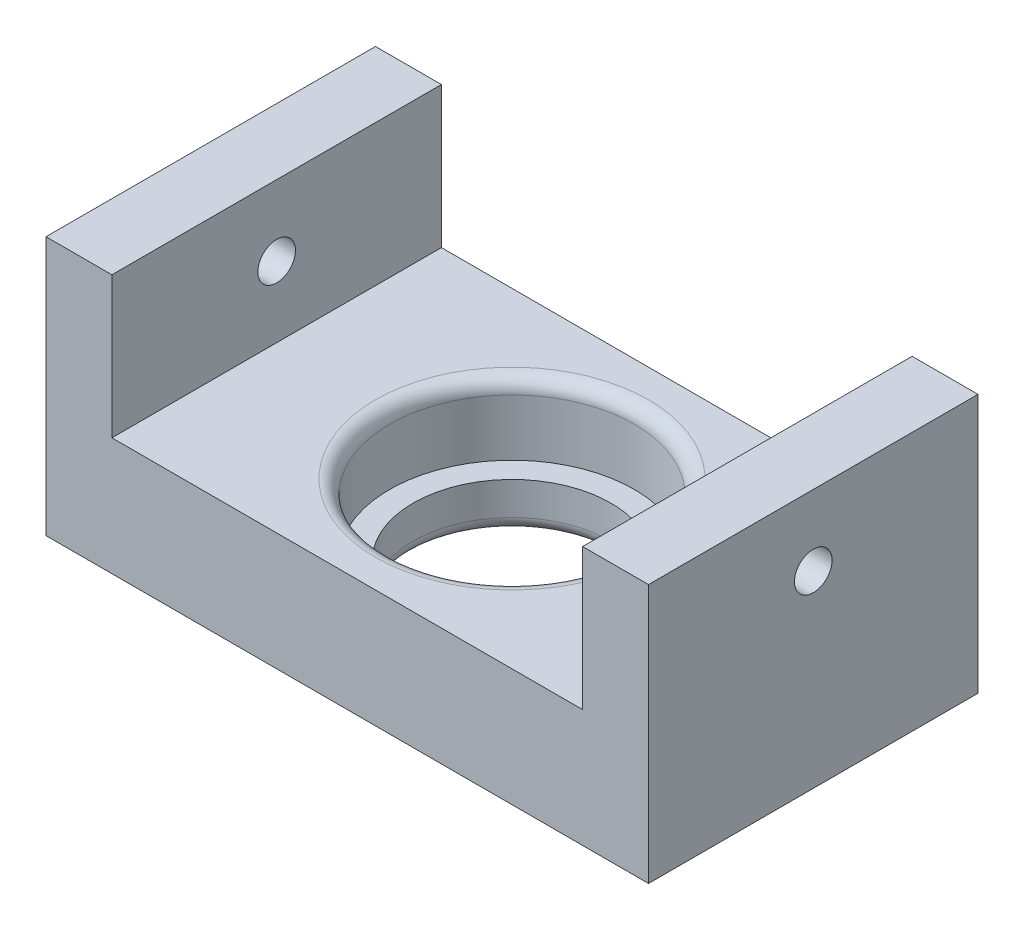
from build123d import *

# Parameters (mm, degrees)
SZKIC2_W                     = 64
SZKIC2_H                     = 35
SZKIC2_R                     = 10.5
DODANIE_WYCI_GNI_CIE1_DEPTH  = 12.5
SZKIC3_R                     = 13
WYTNIJ_WYCI_GNI_CIE1_DEPTH   = 7.5
SZKIC4_W                     = 7
SZKIC4_H                     = 35
DODANIE_WYCI_GNI_CIE2_DEPTH  = 15
SZKIC6_R                     = 2
WYTNIJ_WYCI_GNI_CIE2_DEPTH   = 7
WYTNIJ_WYCI_GNI_CIE3_START   = -7
SZKIC7_R                     = 2
WYTNIJ_WYCI_GNI_CIE3_DEPTH   = 7
ZAOKR_GLENIE2_R              = 1.5
ZAOKR_GLENIE3_R              = 1.5
OBIEKT_PRZENIE_KOPIUJ2_ANGLE = 90


with BuildPart() as part:
    # Szkic2 → Dodanie-wyciągnięcie1 (new body)
    with BuildSketch(Plane.XY):
        Rectangle(SZKIC2_W, SZKIC2_H)
        Circle(SZKIC2_R, mode=Mode.SUBTRACT)
    extrude(amount=DODANIE_WYCI_GNI_CIE1_DEPTH)

    # Szkic3 → Wytnij-wyciągnięcie1 (cut)
    with BuildSketch(Plane.XY.offset(12.5)):
        Circle(SZKIC3_R)
    extrude(amount=-WYTNIJ_WYCI_GNI_CIE1_DEPTH, mode=Mode.SUBTRACT)

    # Szkic4 → Dodanie-wyciągnięcie2 (add)
    with BuildSketch(Plane.XY.offset(12.5)):
        with Locations((-28.5, 0)):
            Rectangle(SZKIC4_W, SZKIC4_H)
        with Locations((28.5, 0)):
            Rectangle(SZKIC4_W, SZKIC4_H)
    extrude(amount=DODANIE_WYCI_GNI_CIE2_DEPTH)

    # Szkic6 → Wytnij-wyciągnięcie2 (cut)
    with BuildSketch(Plane.ZY.offset(-25)):
        with Locations((20, 0)):
            Circle(SZKIC6_R)
    extrude(amount=-WYTNIJ_WYCI_GNI_CIE2_DEPTH, mode=Mode.SUBTRACT)

    # Szkic7 → Wytnij-wyciągnięcie3 (cut)
    with BuildSketch(Plane(origin=(-25, 0, 0), x_dir=(0, 0, -1), z_dir=(1, 0, 0)).offset(WYTNIJ_WYCI_GNI_CIE3_START)):
        with Locations((-20, 0)):
            Circle(SZKIC7_R)
    extrude(amount=WYTNIJ_WYCI_GNI_CIE3_DEPTH, mode=Mode.SUBTRACT)

    # Zaokrąglenie2
    zaokr_glenie2_edges = [part.edges().sort_by_distance(p)[0] for p in [
        (-13, 0, 12.5),
    ]]
    fillet(zaokr_glenie2_edges, radius=ZAOKR_GLENIE2_R)

    # Zaokrąglenie3
    zaokr_glenie3_edges = [part.edges().sort_by_distance(p)[0] for p in [
        (-10.5, 0, 0),
    ]]
    fillet(zaokr_glenie3_edges, radius=ZAOKR_GLENIE3_R)


with BuildPart() as part_1:
    # Obiekt-Przenieś/Kopiuj2: moved
    add(part.part.rotate(Axis((0, 0, 13.75), (-1, 0, 0)), OBIEKT_PRZENIE_KOPIUJ2_ANGLE))


solid = part_1.part
